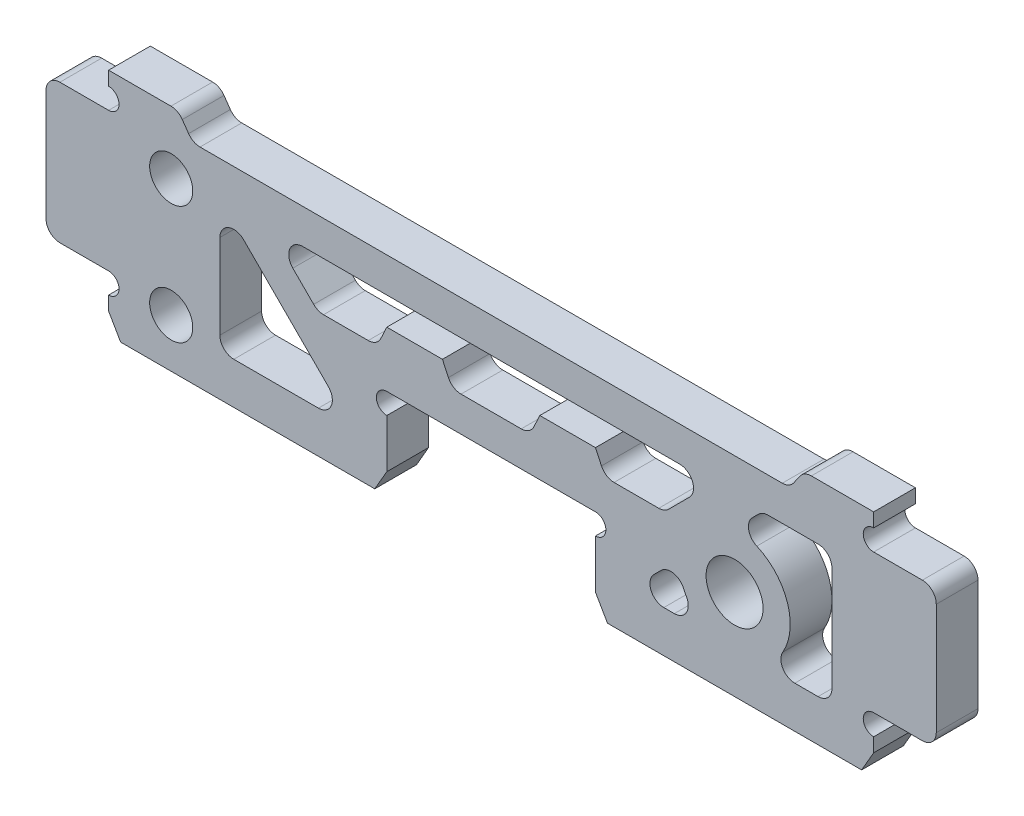
from build123d import *
from OCP.BRepFilletAPI import BRepFilletAPI_MakeChamfer

# Parameters (mm, degrees)
SKETCH_1_R          = 2.05
EXTRUDE_1_DEPTH     = 1.5
SKETCH_2_W          = 4.5
SKETCH_2_H          = 10
EXTRUDE_2_DEPTH     = 3
SKETCH_3_R          = 0.75
CUT_EXTRUDE_1_DEPTH = 51.589030432
FILLET_1_R          = 1
EXTRUDE_3_DEPTH     = 3
CUT_EXTRUDE_2_DEPTH = 51.589030432
FILLET_2_R          = 1
SKETCH_6_R          = 1.55
CUT_EXTRUDE_3_DEPTH = 51.589030432
CUT_EXTRUDE_4_DEPTH = 51.589030432
FILLET_3_R          = 1
CUT_EXTRUDE_5_DEPTH = 51.589030432
FILLET_4_R          = 1
SKETCH_9_W          = 4
SKETCH_9_H          = 1.5
EXTRUDE_4_DEPTH     = 3
CHAMFER_1_SIZE      = 0.699461487
CHAMFER_1_SIZE_2    = 1.5
FILLET_5_R          = 1


with BuildPart() as part:
    # 草图1 → 凸台-拉伸1 (new, symmetric)
    with BuildSketch(Plane.XY):
        Polygon((10, 10), (10, -5), (-10, -5), (-10, 0), (-25, 0), (-25, -5), (-45, -5), (-45, 10), align=None)
        Circle(SKETCH_1_R, mode=Mode.SUBTRACT)
    extrude(amount=EXTRUDE_1_DEPTH, both=True)

    # 草图2 → 凸台-拉伸2 (add)
    with BuildSketch(Plane.XY.offset(1.5)):
        with Locations((12.25, 2.5)):
            Rectangle(SKETCH_2_W, SKETCH_2_H)
        with Locations((-47.25, 2.5)):
            Rectangle(SKETCH_2_W, SKETCH_2_H)
    extrude(amount=-EXTRUDE_2_DEPTH)

    # 草图3 → 切除-拉伸1 (cut, through all)
    with BuildSketch(Plane.XY.offset(1.5)):
        with Locations((-45, 8.25)):
            Circle(SKETCH_3_R)
        with Locations((-45, -3.25)):
            Circle(SKETCH_3_R)
        with Locations((10, 8.25)):
            Circle(SKETCH_3_R)
        with Locations((10, -3.25)):
            Circle(SKETCH_3_R)
        with Locations((-25, -0.75)):
            Circle(SKETCH_3_R)
        with Locations((-10, -0.75)):
            Circle(SKETCH_3_R)
    extrude(amount=-CUT_EXTRUDE_1_DEPTH, mode=Mode.SUBTRACT)

    # 圆角1
    fillet_1_edges = [part.edges().sort_by_distance(p)[0] for p in [
        (14.5, -2.5, 0),
        (14.5, 7.5, 0),
        (-49.5, 7.5, 0),
        (-49.5, -2.5, 0),
    ]]
    fillet(fillet_1_edges, radius=FILLET_1_R)

    # 草图4 → 凸台-拉伸3 (add)
    with BuildSketch(Plane.XY.offset(1.5)):
        Polygon((-10, -5), (-9.133974596, -6.5), (9.133974596, -6.5), (10, -5), align=None)
    extrude_3 = extrude(amount=-EXTRUDE_3_DEPTH)

    # 镜向1: 凸台-拉伸3 across plane
    add(extrude_3.mirror(Plane(origin=(-17.5, 0, 0), x_dir=(0, 0, 1), z_dir=(1, 0, 0))))

    # 草图5 → 切除-拉伸2 (cut, through all)
    with BuildSketch(Plane.XY.offset(1.5)):
        Polygon((-40, 10), (-38.949688693, 8.5), (3.949688693, 8.5), (5, 10), align=None)
    extrude(amount=-CUT_EXTRUDE_2_DEPTH, mode=Mode.SUBTRACT)

    # 圆角2
    fillet_2_edges = [part.edges().sort_by_distance(p)[0] for p in [
        (-40, 10, 0),
        (5, 10, 0),
        (3.949688693, 8.5, 0),
        (-38.949688693, 8.5, 0),
    ]]
    fillet(fillet_2_edges, radius=FILLET_2_R)

    # 草图6 → 切除-拉伸3 (cut, through all)
    with BuildSketch(Plane.XY.offset(1.5)):
        with Locations((-40.5, 5.5)):
            Circle(SKETCH_6_R)
        with Locations((-40.5, -3)):
            Circle(SKETCH_6_R)
    extrude(amount=-CUT_EXTRUDE_3_DEPTH, mode=Mode.SUBTRACT)

    # 草图7 → 切除-拉伸4 (cut, through all)
    with BuildSketch(Plane.XY.offset(1.5)):
        Polygon((-37, 6), (-37, -3.5), (-27.5, -3.5), align=None)
        Polygon((-33.464466094, 6), (-1.535533906, 6), (-5.035533906, 2.5), (-29.964466094, 2.5), align=None)
    extrude(amount=-CUT_EXTRUDE_4_DEPTH, mode=Mode.SUBTRACT)

    # 圆角3
    fillet_3_edges = [part.edges().sort_by_distance(p)[0] for p in [
        (-29.964466094, 2.5, 0),
        (-33.464466094, 6, 0),
        (-1.535533906, 6, 0),
        (-5.035533906, 2.5, 0),
        (-37, 6, 0),
        (-27.5, -3.5, 0),
        (-37, -3.5, 0),
    ]]
    fillet(fillet_3_edges, radius=FILLET_3_R)

    # 草图8 → 切除-拉伸5 (cut, through all)
    with BuildSketch(Plane.XY.offset(1.5)):
        with BuildLine():
            Line((7, 6), (7, -3.5))
            Line((7, -3.5), (1.936491673, -3.5))
            ThreePointArc((1.936491673, -3.5), (3.872983346, 1), (0, 4))
            Line((0, 4), (2, 6))
            Line((2, 6), (7, 6))
        make_face()
        with BuildLine():
            Line((-1.936491673, -3.5), (-7.5, -3.5))
            Line((-7.5, -3.5), (-4, 0))
            ThreePointArc((-4, 0), (-3.445719569, -2.031506006), (-1.936491673, -3.5))
        make_face()
    extrude(amount=-CUT_EXTRUDE_5_DEPTH, mode=Mode.SUBTRACT)

    # 圆角4
    fillet_4_edges = [part.edges().sort_by_distance(p)[0] for p in [
        (2, 6, 0),
        (7, 6, 0),
        (7, -3.5, 0),
        (1.936491673, -3.5, 0),
        (0, 4, 0),
        (-4, 0, 0),
        (-1.936491673, -3.5, 0),
        (-7.5, -3.5, 0),
    ]]
    fillet(fillet_4_edges, radius=FILLET_4_R)

    # 草图9 → 凸台-拉伸4 (add)
    with BuildSketch(Plane.XY.offset(1.5)):
        with Locations((-23, 3.25)):
            Rectangle(SKETCH_9_W, SKETCH_9_H)
        with Locations((-12, 3.25)):
            Rectangle(SKETCH_9_W, SKETCH_9_H)
    extrude(amount=-EXTRUDE_4_DEPTH)

    # 倒角1
    chamfer_1_edges_1 = [part.edges().sort_by_distance(p)[0] for p in [
        (-14, 2.5, 0),
    ]]
    chamfer_1_side_1 = [part.faces().sort_by_distance(p)[0] for p in [
        (-14.01398923, 2.5, 0),
    ]]
    chamfer_1_edges_2 = [part.edges().sort_by_distance(p)[0] for p in [
        (-10, 2.5, 0),
    ]]
    chamfer_1_side_2 = [part.faces().sort_by_distance(p)[0] for p in [
        (-9.98601077, 2.5, 0),
    ]]
    chamfer_1_edges_3 = [part.edges().sort_by_distance(p)[0] for p in [
        (-21, 2.5, 0),
    ]]
    chamfer_1_side_3 = [part.faces().sort_by_distance(p)[0] for p in [
        (-20.98601077, 2.5, 0),
    ]]
    chamfer_1_edges_4 = [part.edges().sort_by_distance(p)[0] for p in [
        (-25, 2.5, 0),
    ]]
    chamfer_1_side_4 = [part.faces().sort_by_distance(p)[0] for p in [
        (-25.01398923, 2.5, 0),
    ]]
    chamfer_1 = BRepFilletAPI_MakeChamfer(part.part.solid().wrapped)
    for e in chamfer_1_edges_1:
        chamfer_1.Add(CHAMFER_1_SIZE - 0.0001, CHAMFER_1_SIZE_2 - 0.0001, e.wrapped, chamfer_1_side_1[0].wrapped)
    for e in chamfer_1_edges_2:
        chamfer_1.Add(CHAMFER_1_SIZE - 0.0001, CHAMFER_1_SIZE_2 - 0.0001, e.wrapped, chamfer_1_side_2[0].wrapped)
    for e in chamfer_1_edges_3:
        chamfer_1.Add(CHAMFER_1_SIZE - 0.0001, CHAMFER_1_SIZE_2 - 0.0001, e.wrapped, chamfer_1_side_3[0].wrapped)
    for e in chamfer_1_edges_4:
        chamfer_1.Add(CHAMFER_1_SIZE - 0.0001, CHAMFER_1_SIZE_2 - 0.0001, e.wrapped, chamfer_1_side_4[0].wrapped)
    add(Compound.cast(chamfer_1.Shape()), mode=Mode.REPLACE)  # a hair under: the kernel refuses the full size

    # 圆角5
    fillet_5_edges = [part.edges().sort_by_distance(p)[0] for p in [
        (-20.300638513, 2.5, 0),
        (-14.699361487, 2.5, 0),
        (-9.300638513, 2.5, 0),
        (-25.699361487, 2.5, 0),
    ]]
    fillet(fillet_5_edges, radius=FILLET_5_R)


solid = part.part
